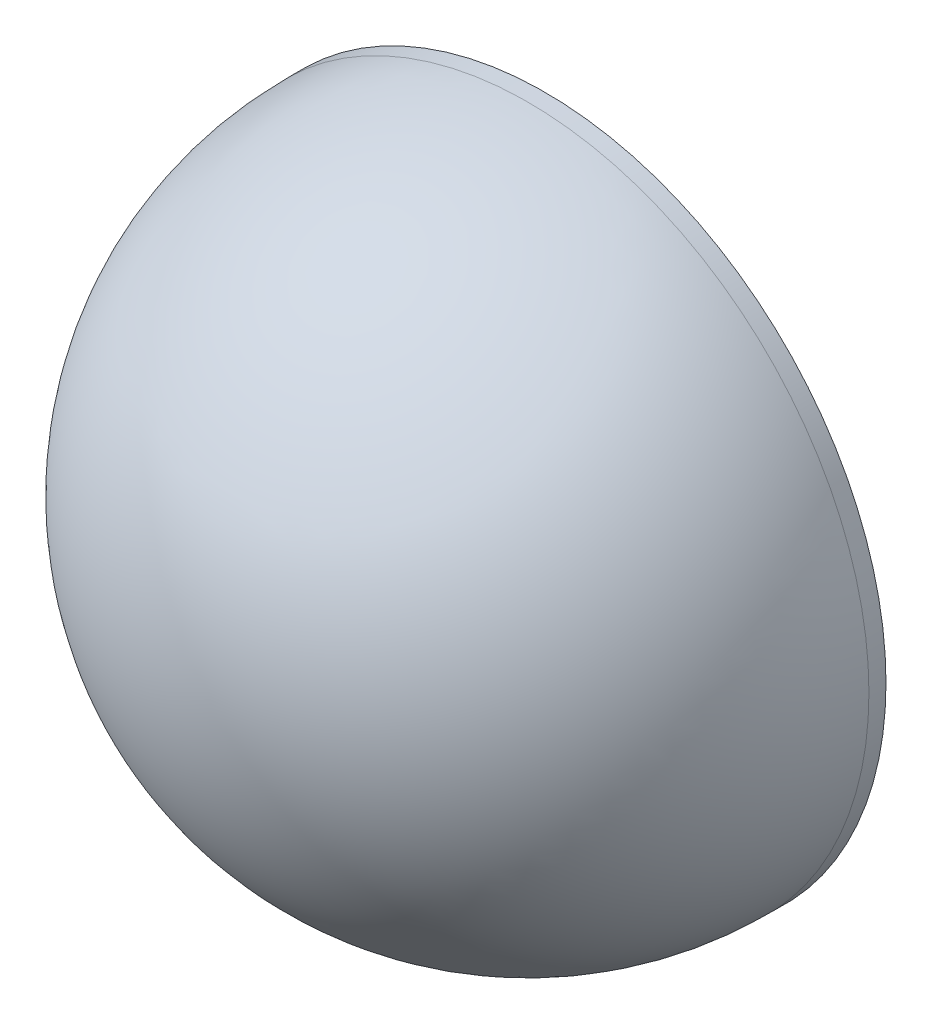
from build123d import *

# Parameters (mm, degrees)
SKETCH1_R           = 20
BOSS_EXTRUDE1_DEPTH = 1
DOME1_FACE_RADIUS   = 20
DOME1_HEIGHT        = 20
SKETCH2_R           = 5
BOSS_EXTRUDE2_DEPTH = 20
SKETCH3_R           = 18.75
BOSS_EXTRUDE3_DEPTH = 1


# Read off the part's stored shape, not the designer's step: Shell1
with BuildPart() as part:
    # Sketch1 → Boss-Extrude1 (new body)
    with BuildSketch(Plane.XY):
        with Locations((-47.148513575, 20.745345973)):
            Circle(SKETCH1_R)
    extrude(amount=BOSS_EXTRUDE1_DEPTH)

    # Dome1: a dome of height H over a round flat face of radius A is a cap of a sphere of radius (A * A + H * H) / (2 * H)
    dome1_r = (DOME1_FACE_RADIUS * DOME1_FACE_RADIUS + DOME1_HEIGHT * DOME1_HEIGHT) / (2 * DOME1_HEIGHT)
    dome1_base = Plane((-47.148513575, 20.745345973, 1), z_dir=(0, 0, 1))
    with Locations(dome1_base.offset(DOME1_HEIGHT - dome1_r)):
        dome1_ball = Sphere(dome1_r, mode=Mode.PRIVATE)
    add(split(dome1_ball, bisect_by=dome1_base, keep=Keep.TOP, mode=Mode.PRIVATE))

    # Shell1 outline → Shell1 (revolve, cut)
    with BuildSketch(Plane(origin=(-47.148513575, 20.745345973, 0), x_dir=(1, 0, 0), z_dir=(0, -1, 0))):
        with BuildLine():
            Line((17, 0), (17, 0.999999983))
            ThreePointArc((17, 0.999999983), (12.020815286, 13.020815274), (0, 18))
            Line((0, 18), (0, 0))
            Line((0, 0), (17, 0))
        make_face()
    revolve(axis=Axis((-47.148513575, 20.745345973, 0), (0, 0, 1)), mode=Mode.SUBTRACT)

    # Sketch2 → Boss-Extrude2 (add)
    with BuildSketch(Plane(origin=(0, 0, 0), x_dir=(-1, 0, 0), z_dir=(0, 0, -1))):
        with Locations((47.148513575, 20.745345973)):
            Circle(SKETCH2_R)
    extrude(amount=-BOSS_EXTRUDE2_DEPTH)

    # Sketch3 → Boss-Extrude3 (add)
    with BuildSketch(Plane(origin=(0, 0, 0), x_dir=(-1, 0, 0), z_dir=(0, 0, -1))):
        with Locations((47.148513575, 20.745345973)):
            Circle(SKETCH3_R)
    extrude(amount=-BOSS_EXTRUDE3_DEPTH)


solid = part.part
